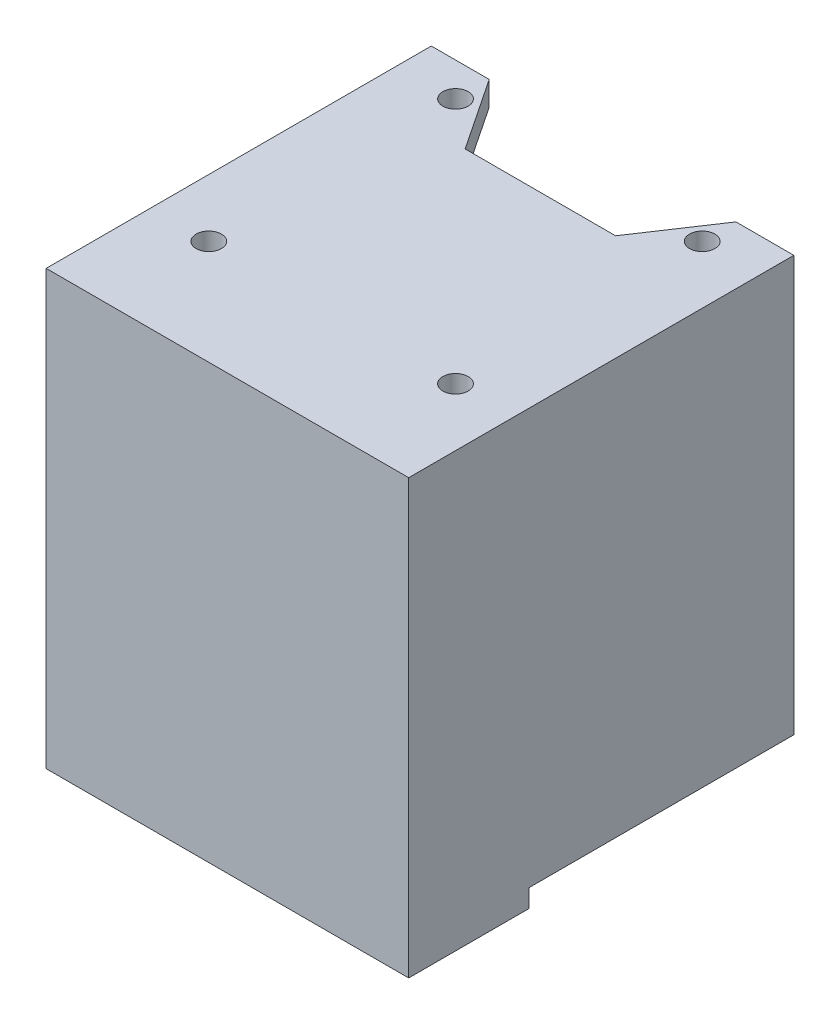
from build123d import *

# Parameters (mm, degrees)
BOSS_EXTRUDE1_DEPTH = 32.5
SKETCH4_R           = 1.05
BOSS_EXTRUDE2_DEPTH = 1.5
SKETCH5_R           = 1.05
BOSS_EXTRUDE3_DEPTH = 2


with BuildPart() as part:
    # Sketch2 → Boss-Extrude1 (new body)
    with BuildSketch(Plane(origin=(0, 0, 0), x_dir=(1, 0, 0), z_dir=(0, 1, 0))):
        Polygon((15.061, 0), (15.061, 32), (12.561, 32), (12.561, 2.5), (-12.561, 2.5), (-12.561, 32), (-15.061, 32), (-15.061, 0), align=None)
    extrude(amount=BOSS_EXTRUDE1_DEPTH)

    # Sketch4 → Boss-Extrude2 (add)
    with BuildSketch(Plane.XZ):
        Polygon((-7.5, -6), (7.5, -6), (12.561, -10), (15.061, -10), (15.061, 0), (-15.061, 0), (-15.061, -10), (-12.561, -10), align=None)
        with Locations((-10.2499, -4.95)):
            Circle(SKETCH4_R, mode=Mode.SUBTRACT)
        with Locations((10.2499, -4.95)):
            Circle(SKETCH4_R, mode=Mode.SUBTRACT)
    extrude(amount=BOSS_EXTRUDE2_DEPTH)

    # Sketch5 → Boss-Extrude3 (add)
    with BuildSketch(Plane(origin=(0, 32.5, 0), x_dir=(1, 0, 0), z_dir=(0, 1, 0))):
        Polygon((-15.061, 32), (-10.2499, 32), (-6.25, 26), (6.25, 26), (10.2499, 32), (15.061, 32), (15.061, 0), (-15.061, 0), align=None)
        with Locations((-10.2499, 8.7)):
            Circle(SKETCH5_R, mode=Mode.SUBTRACT)
        with Locations((10.2499, 8.7)):
            Circle(SKETCH5_R, mode=Mode.SUBTRACT)
        with Locations((-10.2499, 29.2)):
            Circle(SKETCH5_R, mode=Mode.SUBTRACT)
        with Locations((10.2499, 29.2)):
            Circle(SKETCH5_R, mode=Mode.SUBTRACT)
    extrude(amount=BOSS_EXTRUDE3_DEPTH)


solid = part.part
